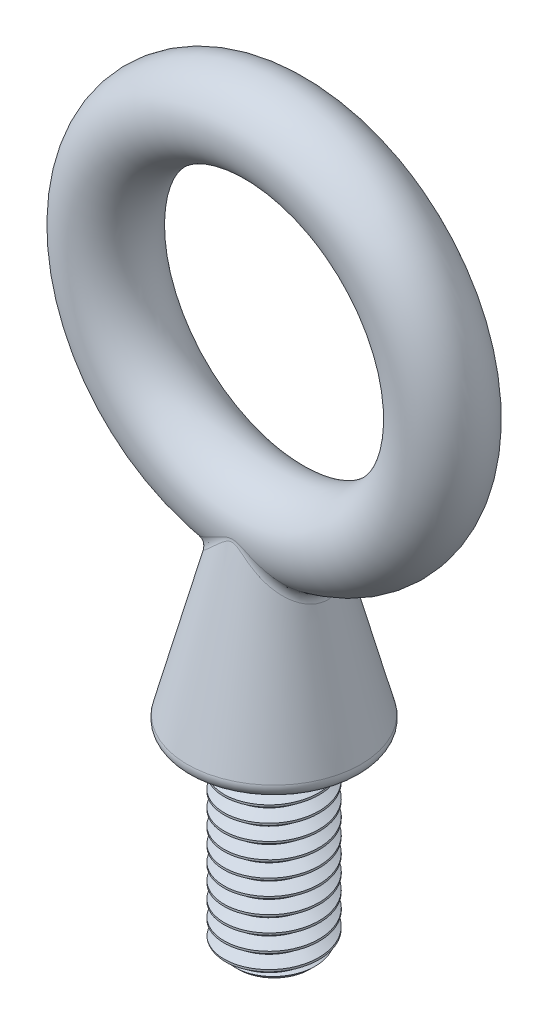
from build123d import *
from build123d.topology import SkipClean

# Parameters (mm, degrees)
BOSS_EXTRUDE1_START = -35.321875
SKETCH2_R           = 4.7625
BOSS_EXTRUDE1_DEPTH = 19.05
CUT_SWEEP1_PITCH    = 1.5875
SKETCH5_OUTSIDE_W   = 58.604
SKETCH5_OUTSIDE_H   = 58.604
SKETCH5_OUTSIDE_R   = 3.559536588
CUT_EXTRUDE1_DEPTH  = 21.205576414
CUT_EXTRUDE1_DRAFT  = -45
SKETCH6_R           = 4.1671875
FILLET1_R           = 1.041796875


with BuildPart() as part:
    # Sketch2 → Boss-Extrude1 (new body)
    with BuildSketch(Plane(origin=(0, 0, 0), x_dir=(1, 0, 0), z_dir=(0, 1, 0)).offset(BOSS_EXTRUDE1_START)):
        with Locations(Location((0, 0, 0), (0, 0, 270))):
            Circle(SKETCH2_R)
    extrude(amount=-BOSS_EXTRUDE1_DEPTH)

    # Cut-Sweep1: the profile of Sketch4 screwed along a right-hand helix of 13 turns, 8 arcs to a turn; built about Z, then put on its axis
    cut_sweep1_z = Axis((0, 0, 0), (0, 0, 1))
    cut_sweep1_corners = [(4.848425958, 0, 0.049609375), (3.731388504, 0, -0.5953125), (3.731388504, 0, -0.79375), (4.848425958, 0, -1.438671875)]
    with BuildLine(mode=Mode.PRIVATE) as cut_sweep1_profile:
        Line(cut_sweep1_corners[0], cut_sweep1_corners[1])
        Line(cut_sweep1_corners[1], cut_sweep1_corners[2])
        Line(cut_sweep1_corners[2], cut_sweep1_corners[3])
        Line(cut_sweep1_corners[3], cut_sweep1_corners[0])
    cut_sweep1_cap = Face(cut_sweep1_profile.wire())
    cut_sweep1_turn_angles = [0, 22.5, 45, 67.5, 90, 112.5, 135, 157.5, 180, 202.5, 225, 247.5, 270, 292.5, 315, 337.5, 360]
    cut_sweep1_turn_weights = [1, 0.9238795325112867, 1, 0.9238795325112867, 1, 0.9238795325112867, 1, 0.9238795325112867, 1, 0.9238795325112867, 1, 0.9238795325112867, 1, 0.9238795325112867, 1, 0.9238795325112867, 1]
    cut_sweep1_turn_rails = [Edge.make_bspline([Vector(p[0], p[1], 0).rotate(cut_sweep1_z, cut_sweep1_turn_angles[k]) / cut_sweep1_turn_weights[k] + Vector(0, 0, p[2] + CUT_SWEEP1_PITCH * cut_sweep1_turn_angles[k] / 360) for k in range(17)], [0, 0, 0, 1, 1, 2, 2, 3, 3, 4, 4, 5, 5, 6, 6, 7, 7, 8, 8, 8], 2, cut_sweep1_turn_weights) for p in cut_sweep1_corners]
    cut_sweep1_turn_sides = [Face.make_surface_from_curves(cut_sweep1_turn_rails[p[0]], cut_sweep1_turn_rails[p[1]]) for p in [(0, 1), (1, 2), (2, 3), (3, 0)]]
    cut_sweep1 = Plane(origin=(0, -54.371875, 0), x_dir=(1, 0, 0), z_dir=(0, 1, 0)) * Solid(Shell([*[p.moved(Location((0, 0, CUT_SWEEP1_PITCH * i))) for i in range(13) for p in cut_sweep1_turn_sides], cut_sweep1_cap, cut_sweep1_cap.rotate(cut_sweep1_z, 4680).moved(Location((0, 0, CUT_SWEEP1_PITCH * 4680 / 360)))]))
    add(cut_sweep1, mode=Mode.SUBTRACT)


with BuildPart() as cut_extrude1_tool:
    # Sketch5 outside → Cut-Extrude1 (with draft: the straight prism first)
    with BuildSketch(Plane.XZ.offset(54.371875)):
        Rectangle(SKETCH5_OUTSIDE_W, SKETCH5_OUTSIDE_H)
        Circle(SKETCH5_OUTSIDE_R, mode=Mode.SUBTRACT)
    extrude(amount=-CUT_EXTRUDE1_DEPTH)
    # Cut-Extrude1: the draft: its side faces are tilted about the plane it starts from
    cut_extrude1_sides = [cut_extrude1_tool.faces().sort_by_distance(p)[0] for p in [
        (0, -43.769086793, -29.302),
        (29.302, -43.769086793, 0),
        (0, -43.769086793, 29.302),
        (-29.302, -43.769086793, 0),
        (-3.559536588, -43.769086793, 0),
    ]]
    draft(cut_extrude1_sides, Plane.XZ.offset(54.371875), CUT_EXTRUDE1_DRAFT)


with BuildPart() as part_1:
    add(part.part)

    # Cut-Extrude1: cut by cut_extrude1_tool
    add(cut_extrude1_tool.part, mode=Mode.SUBTRACT)



with BuildPart() as body_2:
    # Sketch6 → Revolve1 (revolve)
    with BuildSketch(Plane(origin=(0, 0, 0), x_dir=(0, 0, -1), z_dir=(1, 0, 0)), mode=Mode.PRIVATE) as revolve1_sk:
        with Locations((0, 16.8671875)):
            Circle(SKETCH6_R)
    revolve(revolve1_sk.sketch.rotate(Axis((0, 0, -7.63984375), (0, 0, 1)), 90), axis=Axis((0, 0, -7.63984375), (0, 0, 1)))


with BuildPart() as part_2:
    with SkipClean():  # the faces are left unmerged after this step: merging them gives an invalid solid
        add(part_1.part)

        add(body_2.part)  # Revolve2 merges body 2
        # Sketch8 → Revolve2 (revolve)
        with BuildSketch(Plane.XY, mode=Mode.PRIVATE) as revolve2_sk:
            with BuildLine():
                Line((0, -35.321875), (0, -16.8671875))
                Line((0, -16.8671875), (-4.1671875, -16.8671875))
                Line((-4.1671875, -16.8671875), (-8.696699364, -34.014003432))
                ThreePointArc((-8.696699364, -34.014003432), (-8.514842885, -34.915745076), (-7.689453125, -35.321875))
                Line((-7.689453125, -35.321875), (0, -35.321875))
            make_face()
        revolve(revolve2_sk.sketch.rotate(Axis((0, -35.321875, 0), (0, 1, 0)), 180), axis=Axis((0, -35.321875, 0), (0, 1, 0)))

    # Fillet1
    fillet1_edges = [part_2.edges().sort_by_distance(p)[0] for p in [
        (3.36717004, -19.05792962, 3.344500871),
    ]]
    fillet(fillet1_edges, radius=FILLET1_R)


solid = part_2.part
